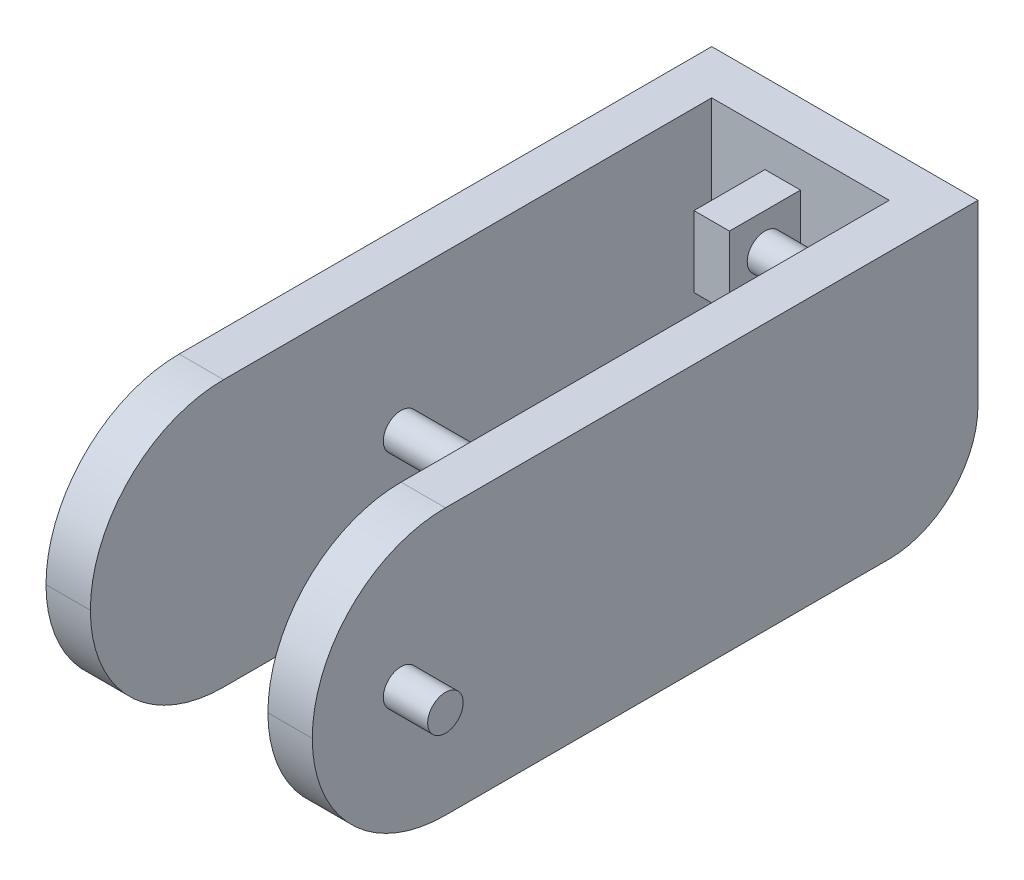
from build123d import *

# Parameters (mm, degrees)
BOSS_EXTRUDE1_DEPTH = 15
SKETCH4_R           = 1
BOSS_EXTRUDE3_DEPTH = 10
SKETCH5_R           = 1
BOSS_EXTRUDE4_DEPTH = 2.5
CUT_EXTRUDE1_REACH  = 43.608
SKETCH6_W           = 10
SKETCH6_H           = 5
FILLET1_R           = 7.5
FILLET2_R           = 5
SKETCH7_W           = 2
SKETCH7_H           = 4
BOSS_EXTRUDE5_DEPTH = 4
SKETCH8_R           = 1
BOSS_EXTRUDE6_DEPTH = 2


with BuildPart() as part:
    # Sketch1 → Boss-Extrude1 (new body)
    with BuildSketch(Plane(origin=(0, 0, 0), x_dir=(1, 0, 0), z_dir=(0, 1, 0))):
        Polygon((-7.5, -17.5), (-7.5, 20), (7.5, 20), (7.5, -17.5), (5, -17.5), (5, 17.5), (-5, 17.5), (-5, -17.5), align=None)
    extrude(amount=BOSS_EXTRUDE1_DEPTH)

    # Sketch4 → Boss-Extrude3 (add)
    with BuildSketch(Plane.ZY.offset(-5)):
        with Locations(Location((0, 7.5, 0), (0, 0, 180))):
            Circle(SKETCH4_R)
    extrude(amount=BOSS_EXTRUDE3_DEPTH)

    # Sketch5 → Boss-Extrude4 (add)
    with BuildSketch(Plane(origin=(7.5, 0, 0), x_dir=(0, 0, -1), z_dir=(1, 0, 0))):
        with Locations(Location((-12.5, 7.5, 0), (0, 0, 180))):
            Circle(SKETCH5_R)
    extrude(amount=BOSS_EXTRUDE4_DEPTH)

    # Sketch6 → Cut-Extrude1 (cut, up to next)
    with BuildSketch(Plane(origin=(0, 0, -20), x_dir=(-1, 0, 0), z_dir=(0, 0, -1)), mode=Mode.PRIVATE) as cut_extrude1_sk1:
        with Locations((0, 2.5)):
            Rectangle(SKETCH6_W, SKETCH6_H)
    cut_extrude1_tool1 = extrude(cut_extrude1_sk1.sketch, amount=-CUT_EXTRUDE1_REACH, mode=Mode.PRIVATE) & part.part
    add(cut_extrude1_tool1.solids().sort_by_distance((0, 2.5, -20))[0], mode=Mode.SUBTRACT)

    # Fillet1
    fillet1_edges = [part.edges().sort_by_distance(p)[0] for p in [
        (-6.25, 0, 17.5),
        (-6.25, 15, 17.5),
        (6.25, 0, 17.5),
        (6.25, 15, 17.5),
    ]]
    fillet(fillet1_edges, radius=FILLET1_R - 0.0001)  # a hair under: the kernel refuses the full size

    # Fillet2
    fillet2_edges = [part.edges().sort_by_distance(p)[0] for p in [
        (6.25, 0, -20),
        (-6.25, 0, -20),
    ]]
    fillet(fillet2_edges, radius=FILLET2_R)

    # Sketch7 → Boss-Extrude5 (add)
    with BuildSketch(Plane.XY.offset(-17.5)):
        with Locations((-1, 11)):
            Rectangle(SKETCH7_W, SKETCH7_H)
    extrude(amount=BOSS_EXTRUDE5_DEPTH)

    # Sketch8 → Boss-Extrude6 (add)
    with BuildSketch(Plane(origin=(0, 0, 0), x_dir=(0, 0, -1), z_dir=(1, 0, 0))):
        with Locations(Location((15.5, 11, 0), (0, 0, 270))):
            Circle(SKETCH8_R)
    extrude(amount=BOSS_EXTRUDE6_DEPTH)


solid = part.part
